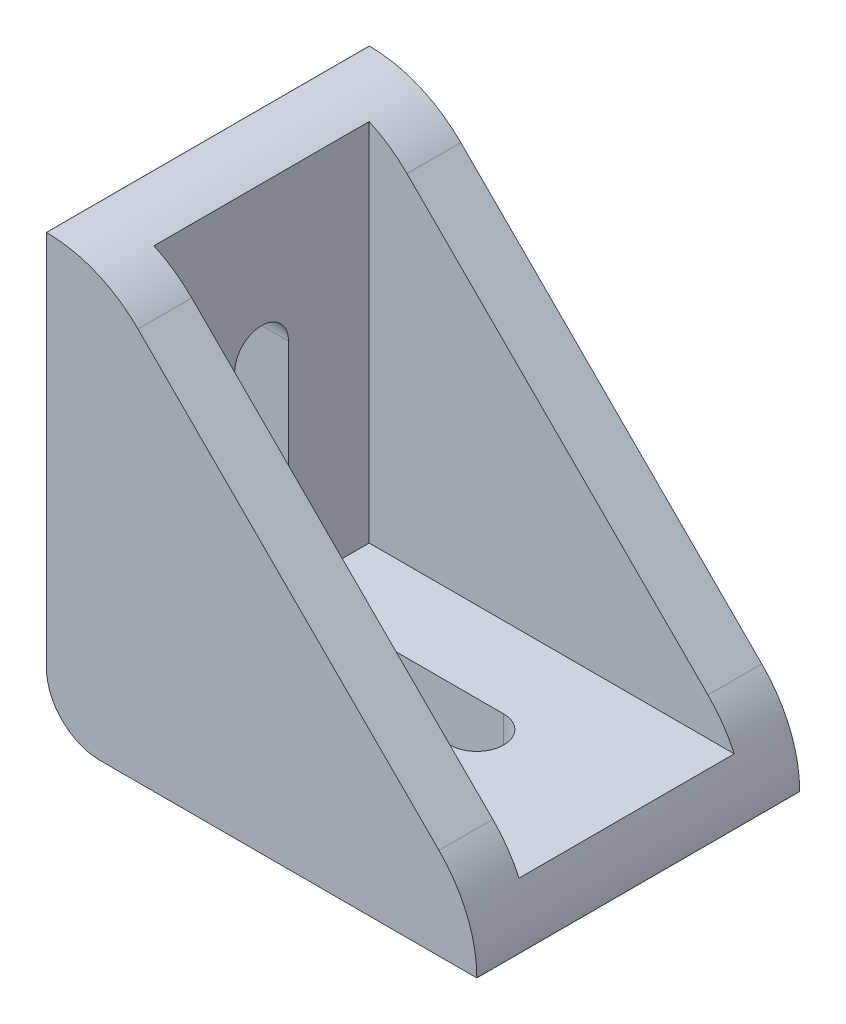
from build123d import *

# Parameters (mm, degrees)
SKETCH1_W           = 40
SKETCH1_H           = 30
BOSS_EXTRUDE1_DEPTH = 5
SKETCH2_W           = 5
SKETCH2_H           = 30
BOSS_EXTRUDE2_DEPTH = 35
BOSS_EXTRUDE3_DEPTH = 5
BOSS_EXTRUDE4_DEPTH = 5
CUT_EXTRUDE1_DEPTH  = 5
CUT_EXTRUDE2_DEPTH  = 5
FILLET4_R           = 12
FILLET5_R           = 12
FILLET6_R           = 5


with BuildPart() as part:
    # Sketch1 → Boss-Extrude1 (new body)
    with BuildSketch(Plane(origin=(0, 0, 0), x_dir=(1, 0, 0), z_dir=(0, 1, 0))):
        with Locations((20, 15)):
            Rectangle(SKETCH1_W, SKETCH1_H)
    extrude(amount=BOSS_EXTRUDE1_DEPTH)

    # Sketch2 → Boss-Extrude2 (add)
    with BuildSketch(Plane(origin=(0, 5, 0), x_dir=(1, 0, 0), z_dir=(0, 1, 0))):
        with Locations((2.5, 15)):
            Rectangle(SKETCH2_W, SKETCH2_H)
    extrude(amount=BOSS_EXTRUDE2_DEPTH)

    # Sketch3 → Boss-Extrude3 (add)
    with BuildSketch(Plane.XY):
        Polygon((5, 40), (40, 5), (5, 5), align=None)
    extrude(amount=-BOSS_EXTRUDE3_DEPTH)

    # Sketch4 → Boss-Extrude4 (add)
    with BuildSketch(Plane(origin=(0, 0, -30), x_dir=(-1, 0, 0), z_dir=(0, 0, -1))):
        Polygon((-40, 5), (-5, 40), (-5, 5), align=None)
    extrude(amount=-BOSS_EXTRUDE4_DEPTH)

    # Sketch5 → Cut-Extrude1 (cut)
    with BuildSketch(Plane.XZ):
        with BuildLine():
            Line((15, -12.5), (25, -12.5))
            ThreePointArc((25, -12.5), (27.5, -15), (25, -17.5))
            Line((25, -17.5), (15, -17.5))
            ThreePointArc((15, -17.5), (12.5, -15), (15, -12.5))
        make_face()
    extrude(amount=-CUT_EXTRUDE1_DEPTH, mode=Mode.SUBTRACT)

    # Sketch6 → Cut-Extrude2 (cut)
    with BuildSketch(Plane.ZY):
        with BuildLine():
            Line((-12.5, 25), (-12.5, 15))
            ThreePointArc((-12.5, 15), (-15, 12.5), (-17.5, 15))
            Line((-17.5, 15), (-17.5, 25))
            ThreePointArc((-17.5, 25), (-15, 27.5), (-12.5, 25))
        make_face()
    extrude(amount=-CUT_EXTRUDE2_DEPTH, mode=Mode.SUBTRACT)

    # Fillet4
    # the kernel refuses this fillet: 12 mm, written as the material it takes off along each edge
    with BuildSketch(Plane(origin=(40, 5, 12.426406871), x_dir=(-0.7071067811865481, 0.707106781186547, 0), z_dir=(0, 0, -1))) as fillet4_piece_1:
        with BuildLine():
            CenterArc((FILLET4_R * 0.414213562373, -FILLET4_R), FILLET4_R, 90, 45)
            Line((-FILLET4_R * 0.292893218813, -FILLET4_R * 0.292893218813), (0, 0))
            Line((0, 0), (FILLET4_R * 0.414213562373, 0))
        make_face()
    extrude(amount=29.852813742, mode=Mode.SUBTRACT)
    with BuildSketch(Plane(origin=(40, 5, -12.573593129), x_dir=(0, -1, 0), z_dir=(0, 0, -1))) as fillet4_piece_2:
        with BuildLine():
            CenterArc((FILLET4_R * 0.414213562373, FILLET4_R), FILLET4_R, 225, 45)
            Line((-FILLET4_R * 0.292893218813, FILLET4_R * 0.292893218813), (0, 0))
            Line((0, 0), (FILLET4_R * 0.414213562373, 0))
        make_face()
    extrude(amount=29.852813742, mode=Mode.SUBTRACT)

    # Fillet5
    # the kernel refuses this fillet: 12 mm, written as the material it takes off along each edge
    with BuildSketch(Plane(origin=(5, 40, -17.426406871), x_dir=(-1, 0, 0), z_dir=(0, 0, 1)), Plane(origin=(5, 40, -42.426406871), x_dir=(-1, 0, 0), z_dir=(0, 0, 1))) as fillet5_piece_1:
        with BuildLine():
            CenterArc((FILLET5_R * 0.414213562373, FILLET5_R), FILLET5_R, 225, 45)
            Line((-FILLET5_R * 0.292893218813, FILLET5_R * 0.292893218813), (0, 0))
            Line((0, 0), (FILLET5_R * 0.414213562373, 0))
        make_face()
    extrude(amount=29.852813742, mode=Mode.SUBTRACT)

    # Fillet6
    fillet6_edges = [part.edges().sort_by_distance(p)[0] for p in [
        (0, 0, -15),
    ]]
    fillet(fillet6_edges, radius=FILLET6_R)


solid = part.part
